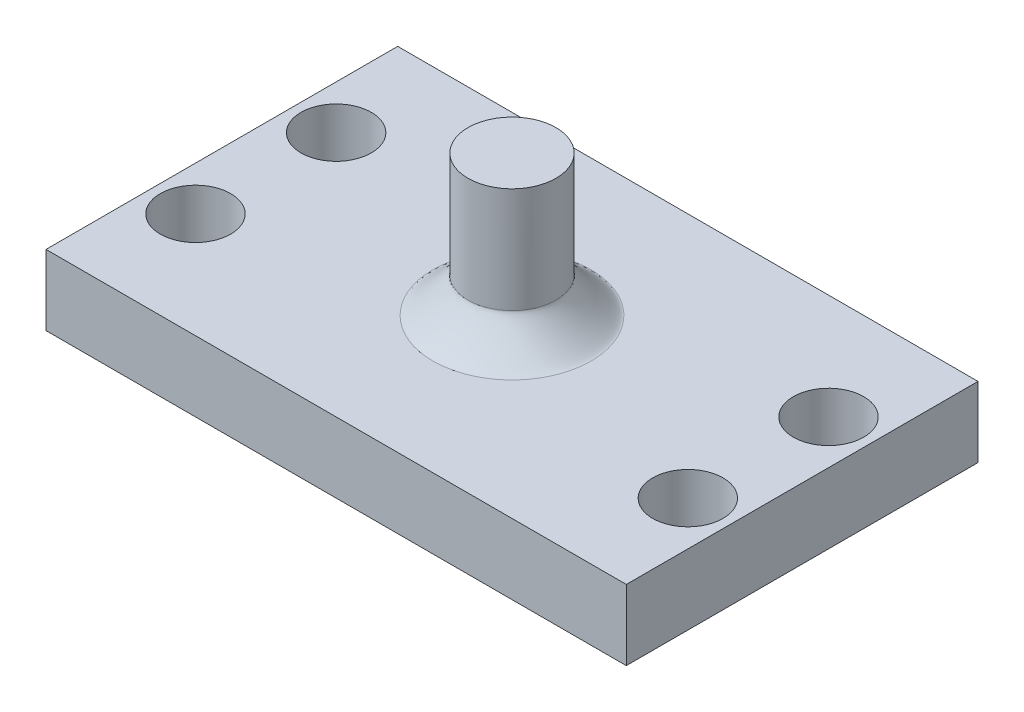
from build123d import *

# Parameters (mm, degrees)
SKETCH1_W           = 33
SKETCH1_H           = 20
BOSS_EXTRUDE1_DEPTH = 2
SKETCH2_R           = 2
CUT_EXTRUDE1_DEPTH  = 20.704060495
SKETCH3_R           = 2.5
BOSS_EXTRUDE2_DEPTH = 8
FILLET1_SIZE        = 2


with BuildPart() as part:
    # Sketch1 → Boss-Extrude1 (new, symmetric)
    with BuildSketch(Plane(origin=(0, 0, 0), x_dir=(1, 0, 0), z_dir=(0, 1, 0))):
        Rectangle(SKETCH1_W, SKETCH1_H)
    extrude(amount=BOSS_EXTRUDE1_DEPTH, both=True)

    # Sketch2 → Cut-Extrude1 (cut, through all)
    with BuildSketch(Plane(origin=(0, 2, 0), x_dir=(1, 0, 0), z_dir=(0, 1, 0))):
        with Locations(Location((-14, 4, 0), (0, 0, 270))):
            Circle(SKETCH2_R)
        with Locations(Location((-14, -4, 0), (0, 0, 270))):
            Circle(SKETCH2_R)
        with Locations(Location((14, -4, 0), (0, 0, 90))):
            Circle(SKETCH2_R)
        with Locations(Location((14, 4, 0), (0, 0, 90))):
            Circle(SKETCH2_R)
    extrude(amount=-CUT_EXTRUDE1_DEPTH, mode=Mode.SUBTRACT)

    # Sketch3 → Boss-Extrude2 (add)
    with BuildSketch(Plane(origin=(0, 2, 0), x_dir=(1, 0, 0), z_dir=(0, 1, 0))):
        with Locations(Location((0, 0, 0), (0, 0, 270))):
            Circle(SKETCH3_R)
    extrude(amount=BOSS_EXTRUDE2_DEPTH)

    # Fillet1
    # a fillet whose section is not a circle: 2 mm, written as the material it adds along each edge
    with BuildSketch(Plane(origin=(0, 2, 0), x_dir=(0, 0, 1), z_dir=(-1, 0, 0))) as fillet1_piece_1:
        with BuildLine():
            Bezier((2.5 + FILLET1_SIZE, 0), (2.5, 0), (2.5, FILLET1_SIZE), weights=[1, 0.141421356, 1])
            Line((2.5, FILLET1_SIZE), (2.5, 0))
            Line((2.5, 0), (2.5 + FILLET1_SIZE, 0))
        make_face()
    revolve(axis=Axis((0, 2, 0), (0, 1, 0)))


solid = part.part
